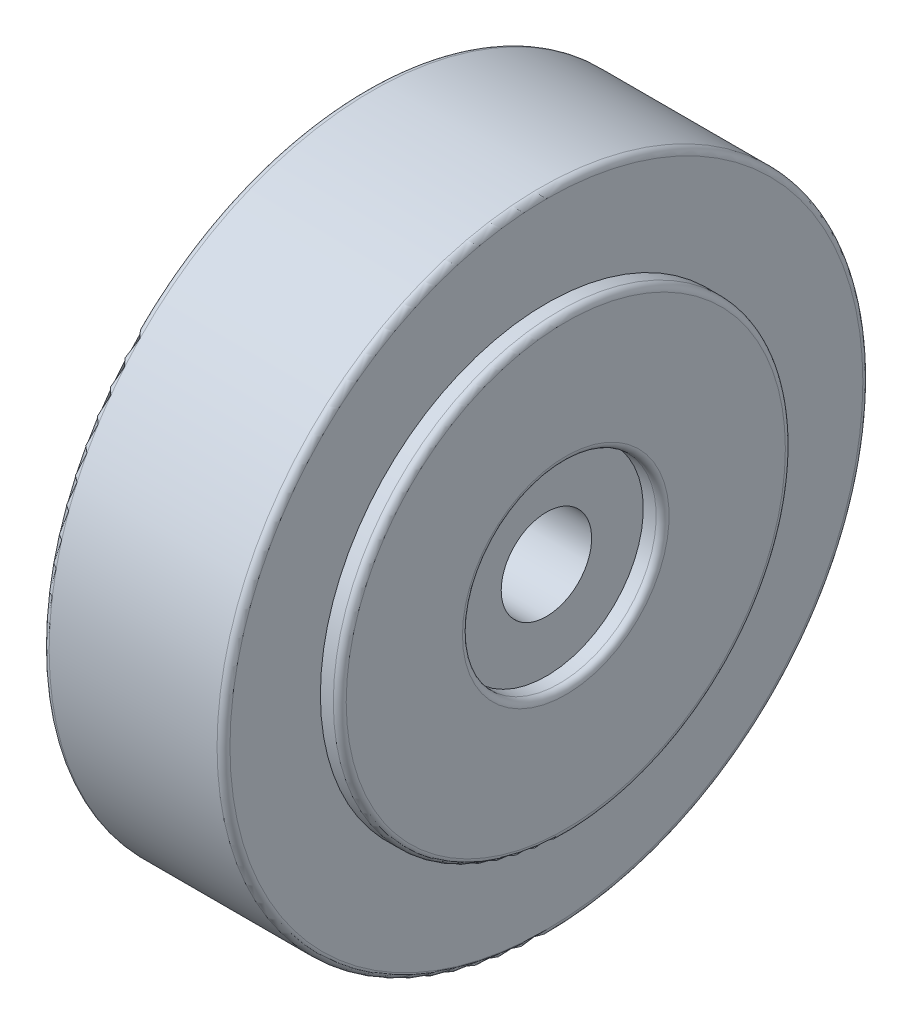
from build123d import *

# Parameters (mm, degrees)
FILLET1_R = 1


with BuildPart() as part:
    # Sketch1 → Revolve1 (revolve)
    with BuildSketch(Plane.XY):
        Polygon((14, 7), (14, 15), (17, 15), (17, 35), (14, 35), (14, 50), (-14, 50), (-14, 35), (-17, 35), (-17, 15), (-14, 15), (-14, 7), align=None)
    revolve(axis=Axis((0, 0, 0), (1, 0, 0)))

    # Fillet1
    fillet1_edges = [part.edges().sort_by_distance(p)[0] for p in [
        (17, -35, 0),
        (14, -50, 0),
        (-17, -35, 0),
        (-17, -15, 0),
        (-14, -50, 0),
        (17, -15, 0),
    ]]
    fillet(fillet1_edges, radius=FILLET1_R)


solid = part.part
